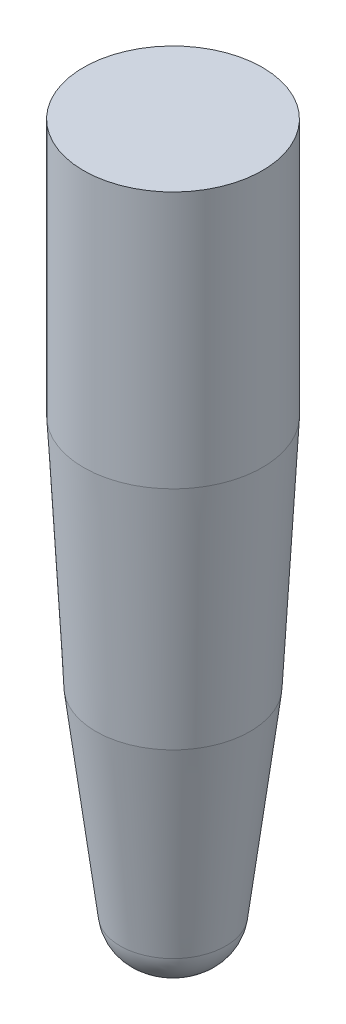
from build123d import *

# Parameters (mm, degrees)
SKETCH_620_R    = 8
EXTRUDE_1_DEPTH = 23


# Read off the part's stored shape, not the designer's step: 凸台-拉伸2
with BuildPart() as part:
    # Sketch 620 → 凸台-拉伸1 (new body)
    with BuildSketch(Plane(origin=(0, 0, 0), x_dir=(1, 0, 0), z_dir=(0, 1, 0))):
        with Locations(Location((0, 0, 0), (0, 0, 270))):
            Circle(SKETCH_620_R)
    extrude(amount=EXTRUDE_1_DEPTH)

    # 凸台-拉伸2 outline → 凸台-拉伸2 (revolve)
    with BuildSketch(Plane.XY):
        Polygon((0, -21), (6.899436635, -21), (8, 0), (0, 0), align=None)
    revolve(axis=Axis((0, 0, 0), (0, 1, 0)))

    # 草图7 → 旋转4 (revolve)
    with BuildSketch(Plane.XY, mode=Mode.PRIVATE) as revolve_4_sk:
        with BuildLine():
            Line((0, -21), (6.899436635, -21))
            Line((6.899436635, -21), (4.725684175, -38.703793083))
            ThreePointArc((4.725684175, -38.703793083), (3.487252632, -41.057664274), (1, -42))
            Line((1, -42), (0, -42))
            Line((0, -42), (0, -21))
        make_face()
    revolve(revolve_4_sk.sketch.rotate(Axis((0, -21, 0), (0, -1, 0)), 180), axis=Axis((0, -21, 0), (0, -1, 0)))


solid = part.part
